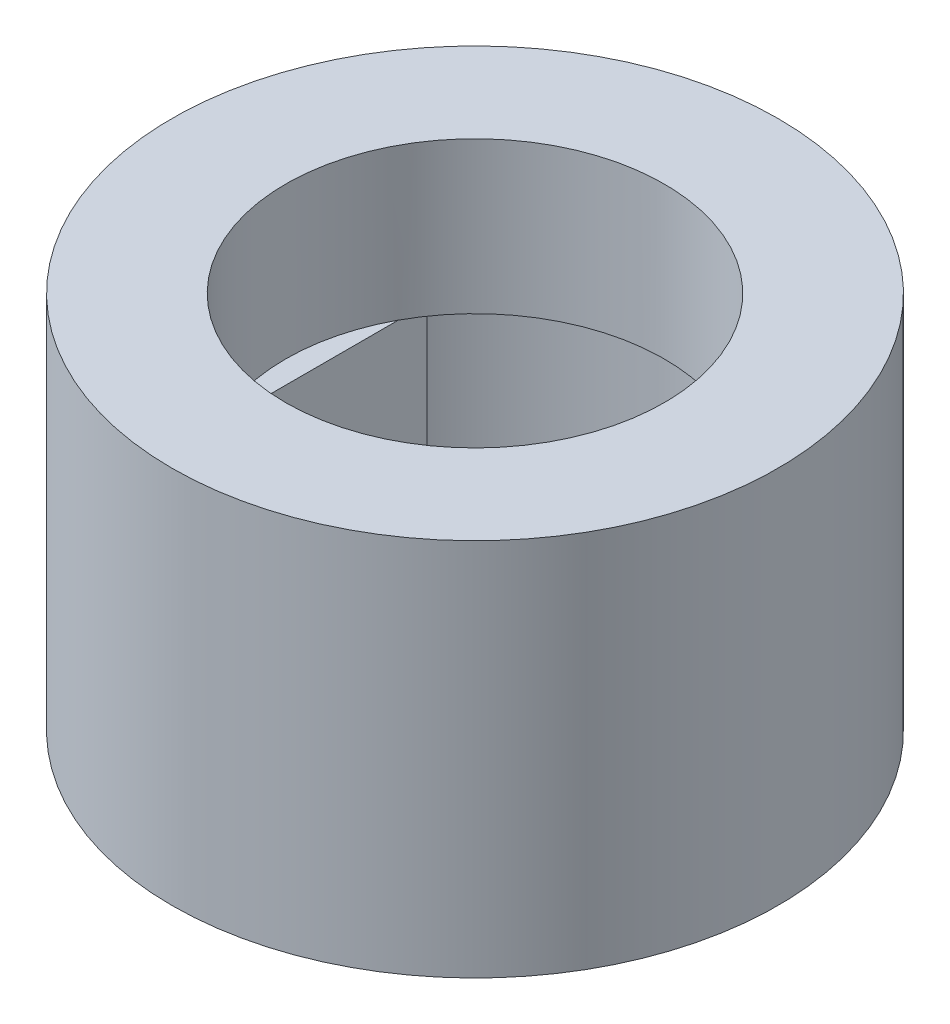
from build123d import *

# Parameters (mm, degrees)
SKETCH1_R           = 5.08
BOSS_EXTRUDE1_DEPTH = 6.35
CUT_EXTRUDE1_DEPTH  = 3.81
SKETCH3_R           = 3.175
CUT_EXTRUDE2_DEPTH  = 2.54


with BuildPart() as part:
    # Sketch1 → Boss-Extrude1 (new body)
    with BuildSketch(Plane(origin=(0, 0, 0), x_dir=(1, 0, 0), z_dir=(0, 1, 0))):
        Circle(SKETCH1_R)
    extrude(amount=BOSS_EXTRUDE1_DEPTH)

    # Sketch2 → Cut-Extrude1 (cut)
    with BuildSketch(Plane(origin=(0, 0, 0), x_dir=(1, 0, 0), z_dir=(0, 1, 0))):
        with BuildLine():
            Line((-2.794, 1.987864432), (-2.794, -1.987864432))
            ThreePointArc((-2.794, -1.987864432), (1.043411472, -3.266394572), (3.429, 0))
            ThreePointArc((3.429, 0), (1.043411472, 3.266394572), (-2.794, 1.987864432))
        make_face()
    extrude(amount=CUT_EXTRUDE1_DEPTH, mode=Mode.SUBTRACT)

    # Sketch3 → Cut-Extrude2 (cut)
    with BuildSketch(Plane(origin=(0, 6.35, 0), x_dir=(1, 0, 0), z_dir=(0, 1, 0))):
        Circle(SKETCH3_R)
    extrude(amount=-CUT_EXTRUDE2_DEPTH, mode=Mode.SUBTRACT)


solid = part.part
